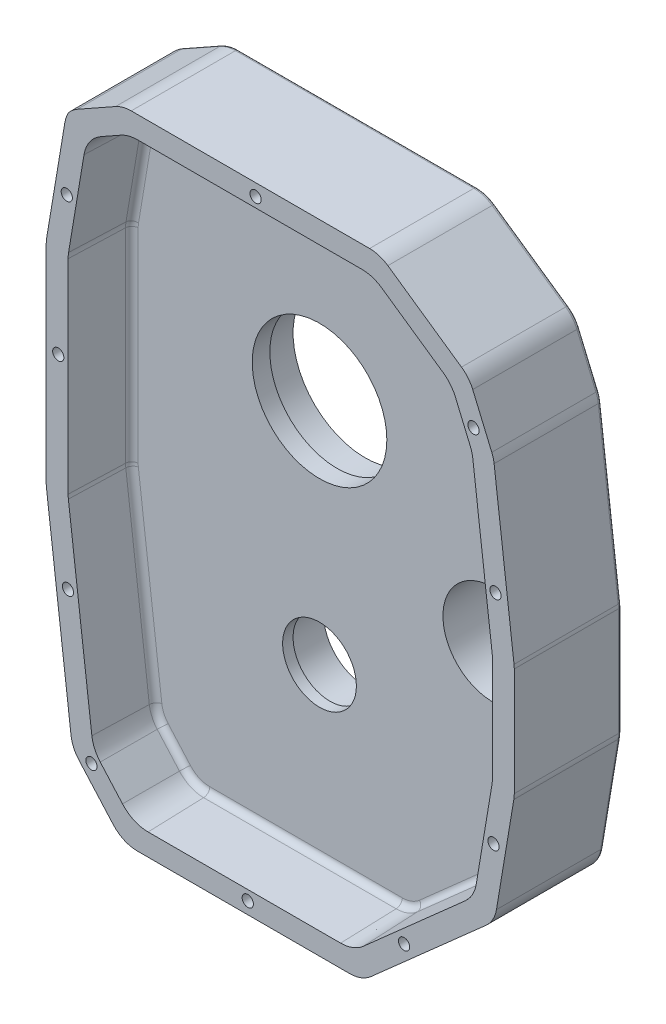
from build123d import *

# Parameters (mm, degrees)
ESTRUSIONE_ESTRUSIONE1_DEPTH   = 77
SCHIZZO2_R                     = 45.00000000000001
SCHIZZO2_R_2                   = 31.00000000000002
SCHIZZO2_R_3                   = 26.000000000000004
TAGLIO_ESTRUSIONE1_DEPTH       = 485.5269982106822
TAGLIO_ESTRUSIONE2_DEPTH       = 48.5
FORO_FILETTATO_M8_1_AT_2_COUNT = 2
FORO_FILETTATO_M8_1_AT_2_PITCH = 103.92304845413265
FORO_FILETTATO_M8_1_AT_3_COUNT = 2
FORO_FILETTATO_M8_1_AT_3_PITCH = 103.92304845413267
FORO_FILETTATO_M8_1_AT_4_COUNT = 2
FORO_FILETTATO_M8_1_AT_4_PITCH = 146.24517509154336
FORO_FILETTATO_M8_1_AT_5_COUNT = 2
FORO_FILETTATO_M8_1_AT_5_PITCH = 173.75803258941207
FORO_FILETTATO_M8_1_AT_6_COUNT = 2
FORO_FILETTATO_M8_1_AT_6_PITCH = 211.6200982542094
FORO_FILETTATO_M8_1_AT_7_COUNT = 2
FORO_FILETTATO_M8_1_AT_7_PITCH = 168.5
FORO_FILETTATO_M8_1_AT_8_COUNT = 2
FORO_FILETTATO_M8_1_AT_8_PITCH = 221.46613736641547
FORO_FILETTATO_M8_1_AT_9_COUNT = 2
FORO_FILETTATO_M8_1_AT_9_PITCH = 221.46613736641547
SCHIZZO10_R                    = 3.5000000000000075
SCHIZZO10_R_2                  = 3.500000000000021
SCHIZZO10_R_3                  = 3.500000000000001
SCHIZZO10_R_4                  = 3.500000000000007
SCHIZZO10_R_5                  = 3.4999999999999933
SCHIZZO10_R_6                  = 3.4999999999999996
TAGLIO_ESTRUSIONE3_DEPTH       = 485.5269982106822
TAGLIO_ESTRUSIONE4_START       = 77
TAGLIO_ESTRUSIONE4_DEPTH       = 87
RACCORDO1_R                    = 20
RACCORDO2_R                    = 2
ESTRUSIONE_ESTRUSIONE3_START   = -11
SCHIZZO12_R                    = 44.99999999999998
SCHIZZO12_R_2                  = 41.99999999999998
ESTRUSIONE_ESTRUSIONE3_DEPTH   = 11
ESTRUSIONE_ESTRUSIONE4_START   = -6.5
SCHIZZO13_R                    = 26.000000000000004
SCHIZZO13_R_2                  = 22.999999999999986
ESTRUSIONE_ESTRUSIONE4_DEPTH   = 6.5
RACCORDO4_R                    = 20
SFORMO1_ANGLE                  = 2.0000000000000044
RACCORDO5_R                    = 4


with BuildPart() as part:
    # Schizzo1 → Estrusione-Estrusione1 (new body)
    with BuildSketch(Plane.XY):
        Polygon((59.97203866307139, -9.548657155468725), (184.10741549748292, -9.548657155468723), (266.9069284985725, 63.82426858351747), (279.1826753889554, 137.3777870418758), (279.1826753889554, 207.62899219262553), (266.2641129808191, 313.83800459040253), (251.0013978020814, 349.7306588644845), (195.19631847388604, 388.4513428445313), (34.97510700608368, 388.45134284453127), (2.5691605785714486, 370.25525465443536), (-0.4487972003918185, 365.90570924477845), (-12.817324611044688, 291.79627074577445), (-12.817324611044684, 270.1406472453184), (-12.817324611044674, 159.54273071121807), (-8.096788353345598, 120.73318843565089), (-1.2777496964637207, 64.67096275072858), (3.418345684776214, 26.06235934659699), (34.97510700608368, -9.548657155468725), align=None)
    estrusione_estrusione1 = extrude(amount=ESTRUSIONE_ESTRUSIONE1_DEPTH)

    # Schizzo2 → Taglio-Estrusione1 (cut, through all)
    with BuildSketch(Plane.XY.offset(77)):
        with Locations((119.18267538895532, 251.95134284453124)):
            Circle(SCHIZZO2_R)
        with Locations((227.1857552774219, 174.34614028319743)):
            Circle(SCHIZZO2_R_2)
        with Locations((119.18267538895533, 109.45134284453127)):
            Circle(SCHIZZO2_R_3)
    taglio_estrusione1 = extrude(amount=-TAGLIO_ESTRUSIONE1_DEPTH, mode=Mode.SUBTRACT)

    # Schizzo4 → Taglio-Estrusione2 (cut)
    with BuildSketch(Plane(origin=(0, 0, 0), x_dir=(-1, 0, 0), z_dir=(0, 0, -1))):
        Polygon((-190.50206074448187, 373.4513428445313), (-238.89227938799723, 339.8755037564531), (-251.63003788980453, 309.9206787611581), (-264.1826753889553, 206.72009113753535), (-264.1826753889553, 138.62090581781547), (-252.98547965028263, 71.52982363759074), (-178.41756547195982, 5.451342844531276), (-41.72490216868169, 5.451342844531273), (-17.744303444365826, 32.512849195134365), (-2.1826753889553263, 160.4516317663086), (-2.1826753889553108, 290.55315196983486), (-13.652120373026488, 359.27549048627293), (-38.898311053509296, 373.45134284453127), align=None)
    taglio_estrusione2 = extrude(amount=-TAGLIO_ESTRUSIONE2_DEPTH, mode=Mode.SUBTRACT)

    # Schizzo9 → Foro filettato M8-1 (revolve, cut)
    with BuildSketch(Plane(origin=(119.18267538895532, 311.95134284453127, 77), x_dir=(0, -1, 0), z_dir=(1, 0, 0))):
        Polygon((0, 0), (-6.13e-15, 25.042926104693706), (3.3999999999999946, 23), (3.3999999999999972, 0.625000000000004), (4.025, 0), align=None)
    foro_filettato_m8_1 = revolve(axis=Axis((119.18267538895532, 311.95134284453127, 83.35), (0, 0, -1)), mode=Mode.SUBTRACT)

    # Foro filettato M8-1 at 2: Foro filettato M8-1 ×2
    with Locations(*[Vector(-0.5000000000000003, -0.8660254037844385, 0) * (i * FORO_FILETTATO_M8_1_AT_2_PITCH) for i in range(1, FORO_FILETTATO_M8_1_AT_2_COUNT)]):
        add(foro_filettato_m8_1, mode=Mode.SUBTRACT)

    # Foro filettato M8-1 at 3: Foro filettato M8-1 ×2
    with Locations(*[Vector(0.4999999999999996, -0.8660254037844389, 0) * (i * FORO_FILETTATO_M8_1_AT_3_PITCH) for i in range(1, FORO_FILETTATO_M8_1_AT_3_COUNT)]):
        add(foro_filettato_m8_1, mode=Mode.SUBTRACT)

    # Foro filettato M8-1 at 4: Foro filettato M8-1 ×2
    with Locations(*[Vector(0.7385069614834211, -0.6742458511852519, 0) * (i * FORO_FILETTATO_M8_1_AT_4_PITCH) for i in range(1, FORO_FILETTATO_M8_1_AT_4_COUNT)]):
        add(foro_filettato_m8_1, mode=Mode.SUBTRACT)

    # Foro filettato M8-1 at 5: Foro filettato M8-1 ×2
    with Locations(*[Vector(0.42719227442148505, -0.9041608046551226, 0) * (i * FORO_FILETTATO_M8_1_AT_5_PITCH) for i in range(1, FORO_FILETTATO_M8_1_AT_5_COUNT)]):
        add(foro_filettato_m8_1, mode=Mode.SUBTRACT)

    # Foro filettato M8-1 at 6: Foro filettato M8-1 ×2
    with Locations(*[Vector(0.6699650543860357, -0.7423926359424078, 0) * (i * FORO_FILETTATO_M8_1_AT_6_PITCH) for i in range(1, FORO_FILETTATO_M8_1_AT_6_COUNT)]):
        add(foro_filettato_m8_1, mode=Mode.SUBTRACT)

    # Foro filettato M8-1 at 7: Foro filettato M8-1 ×2
    with Locations(*[(0, -i * FORO_FILETTATO_M8_1_AT_7_PITCH, 0) for i in range(1, FORO_FILETTATO_M8_1_AT_7_COUNT)]):
        add(foro_filettato_m8_1, mode=Mode.SUBTRACT)

    # Foro filettato M8-1 at 8: Foro filettato M8-1 ×2
    with Locations(*[Vector(-0.13295424789910176, -0.9911221761042299, 0) * (i * FORO_FILETTATO_M8_1_AT_8_PITCH) for i in range(1, FORO_FILETTATO_M8_1_AT_8_COUNT)]):
        add(foro_filettato_m8_1, mode=Mode.SUBTRACT)

    # Foro filettato M8-1 at 9: Foro filettato M8-1 ×2
    with Locations(*[Vector(0.13295424789910176, -0.9911221761042299, 0) * (i * FORO_FILETTATO_M8_1_AT_9_PITCH) for i in range(1, FORO_FILETTATO_M8_1_AT_9_COUNT)]):
        add(foro_filettato_m8_1, mode=Mode.SUBTRACT)

    # Schizzo10 → Taglio-Estrusione3 (cut, through all)
    with BuildSketch(Plane(origin=(0, 0, 0), x_dir=(-1, 0, 0), z_dir=(0, 0, -1))):
        with Locations((-117.80707355078968, 380.95134284453127)):
            Circle(SCHIZZO10_R)
        with Locations((-253.77198100419457, 324.04938305286004)):
            Circle(SCHIZZO10_R_2)
        with Locations((5.317324611044673, 234.1316845005394)):
            Circle(SCHIZZO10_R_3)
        with Locations((-266.25474899561414, 105.47643049419624)):
            Circle(SCHIZZO10_R_2)
        with Locations((-0.7392385346214547, 110.2035919907182)):
            Circle(SCHIZZO10_R_3)
        with Locations((-112.91910280426978, -2.0486571554687236)):
            Circle(SCHIZZO10_R_4)
        with Locations((0.0028470657826218, 323.0178672743057)):
            Circle(SCHIZZO10_R_3)
        with Locations((-267.4811778656179, 241.7168450923049)):
            Circle(SCHIZZO10_R_2)
        with Locations((-210.41910280426978, 23.451342844531275)):
            Circle(SCHIZZO10_R_5)
        with Locations((-15.41910280426978, 23.451342844531275)):
            Circle(SCHIZZO10_R_6)
    taglio_estrusione3 = extrude(amount=-TAGLIO_ESTRUSIONE3_DEPTH, mode=Mode.SUBTRACT)

    # Specchia1: Estrusione-Estrusione1, Taglio-Estrusione1, Taglio-Estrusione2, Foro filettato M8-1, Taglio-Estrusione3 across Front Plane
    add(estrusione_estrusione1.mirror(Plane.XY))
    add(taglio_estrusione1.mirror(Plane.XY), mode=Mode.SUBTRACT)
    add(taglio_estrusione2.mirror(Plane.XY), mode=Mode.SUBTRACT)
    add(foro_filettato_m8_1.mirror(Plane.XY), mode=Mode.SUBTRACT)
    add(taglio_estrusione3.mirror(Plane.XY), mode=Mode.SUBTRACT)

    # Specchia1 copy 1 sketch → Specchia1 copy 1 (revolve, cut)
    with BuildSketch(Plane(origin=(67.22115116188895, 221.95134284453127, -77), x_dir=(0, -1, 0), z_dir=(1, 0, 0))):
        Polygon((0, 0), (-6.13e-15, -25.042926104693706), (3.3999999999999946, -23), (3.3999999999999972, -0.625000000000004), (4.025, 0), align=None)
    revolve(axis=Axis((67.22115116188895, 221.95134284453127, -83.35), (0, 0, -1)), mode=Mode.SUBTRACT)

    # Specchia1 copy 2 sketch → Specchia1 copy 2 (revolve, cut)
    with BuildSketch(Plane(origin=(171.1441996160216, 221.9513428445312, -77), x_dir=(0, -1, 0), z_dir=(1, 0, 0))):
        Polygon((0, 0), (-6.13e-15, -25.042926104693706), (3.3999999999999946, -23), (3.3999999999999972, -0.625000000000004), (4.025, 0), align=None)
    revolve(axis=Axis((171.1441996160216, 221.9513428445312, -83.35), (0, 0, -1)), mode=Mode.SUBTRACT)

    # Specchia1 copy 3 sketch → Specchia1 copy 3 (revolve, cut)
    with BuildSketch(Plane(origin=(227.1857552774219, 213.34614028319743, -77), x_dir=(0, -1, 0), z_dir=(1, 0, 0))):
        Polygon((0, 0), (-6.13e-15, -25.042926104693706), (3.3999999999999946, -23), (3.3999999999999972, -0.625000000000004), (4.025, 0), align=None)
    revolve(axis=Axis((227.1857552774219, 213.34614028319743, -83.35), (0, 0, -1)), mode=Mode.SUBTRACT)

    # Specchia1 copy 4 sketch → Specchia1 copy 4 (revolve, cut)
    with BuildSketch(Plane(origin=(193.41076452982878, 154.84614028319743, -77), x_dir=(0, -1, 0), z_dir=(1, 0, 0))):
        Polygon((0, 0), (-6.13e-15, -25.042926104693706), (3.3999999999999946, -23), (3.3999999999999972, -0.625000000000004), (4.025, 0), align=None)
    revolve(axis=Axis((193.41076452982878, 154.84614028319743, -83.35), (0, 0, -1)), mode=Mode.SUBTRACT)

    # Specchia1 copy 5 sketch → Specchia1 copy 5 (revolve, cut)
    with BuildSketch(Plane(origin=(260.96074602501494, 154.84614028319743, -77), x_dir=(0, -1, 0), z_dir=(1, 0, 0))):
        Polygon((0, 0), (-6.13e-15, -25.042926104693706), (3.3999999999999946, -23), (3.3999999999999972, -0.625000000000004), (4.025, 0), align=None)
    revolve(axis=Axis((260.96074602501494, 154.84614028319743, -83.35), (0, 0, -1)), mode=Mode.SUBTRACT)

    # Specchia1 copy 6 sketch → Specchia1 copy 6 (revolve, cut)
    with BuildSketch(Plane(origin=(119.18267538895533, 143.45134284453127, -77), x_dir=(0, -1, 0), z_dir=(1, 0, 0))):
        Polygon((0, 0), (-6.13e-15, -25.042926104693706), (3.3999999999999946, -23), (3.3999999999999972, -0.625000000000004), (4.025, 0), align=None)
    revolve(axis=Axis((119.18267538895533, 143.45134284453127, -83.35), (0, 0, -1)), mode=Mode.SUBTRACT)

    # Specchia1 copy 7 sketch → Specchia1 copy 7 (revolve, cut)
    with BuildSketch(Plane(origin=(89.7378116602844, 92.45134284453127, -77), x_dir=(0, -1, 0), z_dir=(1, 0, 0))):
        Polygon((0, 0), (-6.13e-15, -25.042926104693706), (3.3999999999999946, -23), (3.3999999999999972, -0.625000000000004), (4.025, 0), align=None)
    revolve(axis=Axis((89.7378116602844, 92.45134284453127, -83.35), (0, 0, -1)), mode=Mode.SUBTRACT)

    # Specchia1 copy 8 sketch → Specchia1 copy 8 (revolve, cut)
    with BuildSketch(Plane(origin=(148.62753911762624, 92.45134284453127, -77), x_dir=(0, -1, 0), z_dir=(1, 0, 0))):
        Polygon((0, 0), (-6.13e-15, -25.042926104693706), (3.3999999999999946, -23), (3.3999999999999972, -0.625000000000004), (4.025, 0), align=None)
    revolve(axis=Axis((148.62753911762624, 92.45134284453127, -83.35), (0, 0, -1)), mode=Mode.SUBTRACT)

    # Schizzo1<2> → Taglio-Estrusione4 (cut)
    with BuildSketch(Plane.XY.offset(TAGLIO_ESTRUSIONE4_START)):
        Polygon((59.97203866307139, -9.548657155468725), (184.10741549748292, -9.548657155468723), (266.9069284985725, 63.82426858351747), (279.1826753889554, 137.3777870418758), (279.1826753889554, 207.62899219262553), (266.2641129808191, 313.83800459040253), (251.0013978020814, 349.7306588644845), (195.19631847388604, 388.4513428445313), (34.97510700608368, 388.45134284453127), (2.5691605785714486, 370.25525465443536), (-0.4487972003918185, 365.90570924477845), (-12.817324611044688, 291.79627074577445), (-12.817324611044684, 270.1406472453184), (-12.817324611044674, 159.54273071121807), (-8.096788353345598, 120.73318843565089), (-1.2777496964637207, 64.67096275072858), (3.418345684776214, 26.06235934659699), (34.97510700608368, -9.548657155468725), align=None)
    extrude(amount=-TAGLIO_ESTRUSIONE4_DEPTH, mode=Mode.SUBTRACT)

    # Raccordo1
    # the kernel refuses this fillet: 20 mm, written as the material it takes off along each edge
    with BuildSketch(Plane(origin=(195.19631847388604, 388.4513428445313, -92.64752576468064), x_dir=(0.8215964420750854, -0.570069545204408, 0), z_dir=(0, 0, 1))) as raccordo1_piece_1:
        with BuildLine():
            CenterArc((RACCORDO1_R * 0.312950515294, -RACCORDO1_R), RACCORDO1_R, 90.00000000000003, 34.75507549437218)
            Line((-RACCORDO1_R * 0.257119029911, -RACCORDO1_R * 0.178403557925), (0, 0))
            Line((0, 0), (RACCORDO1_R * 0.312950515294, 1e-16))
        make_face()
    extrude(amount=98.29505152936127, mode=Mode.SUBTRACT)
    with BuildSketch(Plane(origin=(34.975107006083675, 388.45134284453127, 3.0773468247521976), x_dir=(1, 0, 0), z_dir=(0, 0, -1))) as raccordo1_piece_2:
        with BuildLine():
            CenterArc((RACCORDO1_R * 0.261546936495, RACCORDO1_R), RACCORDO1_R, 240.68558878839565, 29.314411211604295)
            Line((-RACCORDO1_R * 0.228054845331, RACCORDO1_R * 0.128053846139), (0, 0))
            Line((0, 0), (RACCORDO1_R * 0.261546936495, 0))
        make_face()
    extrude(amount=93.15469364950437, mode=Mode.SUBTRACT)
    with BuildSketch(Plane(origin=(-0.44879720039181487, 365.90570924477845, 1.2129806364600881), x_dir=(-0.16461853760397155, -0.9863573070024523, 0), z_dir=(0, 0, -1))) as raccordo1_piece_3:
        with BuildLine():
            CenterArc((RACCORDO1_R * 0.224259612729, -RACCORDO1_R), RACCORDO1_R, 90.00000000000014, 25.280000228329982)
            Line((-RACCORDO1_R * 0.202782643888, -RACCORDO1_R * 0.0957683310879), (0, 0))
            Line((0, 0), (RACCORDO1_R * 0.224259612729, -9e-17))
        make_face()
    extrude(amount=89.42596127292018, mode=Mode.SUBTRACT)
    with BuildSketch(Plane(origin=(2.5691605785714513, 370.25525465443536, 1.511478705269397), x_dir=(-0.5700695452044089, -0.821596442075085, 0), z_dir=(0, 0, -1))) as raccordo1_piece_4:
        with BuildLine():
            CenterArc((RACCORDO1_R * 0.230229574105, -RACCORDO1_R), RACCORDO1_R, 90.00000000000009, 25.9305132940234)
            Line((-RACCORDO1_R * 0.207051218491, -RACCORDO1_R * 0.100674970644), (0, 0))
            Line((0, 0), (RACCORDO1_R * 0.230229574105, -2e-17))
        make_face()
    extrude(amount=90.02295741053878, mode=Mode.SUBTRACT)
    with BuildSketch(Plane(origin=(-12.817324611044688, 291.79627074577445, -5.8562707468679776), x_dir=(0, -1, 0), z_dir=(0, 0, -1))) as raccordo1_piece_5:
        with BuildLine():
            CenterArc((RACCORDO1_R * 0.0828745850626, -RACCORDO1_R), RACCORDO1_R, 90, 9.475075266042111)
            Line((-RACCORDO1_R * 0.0817439525413, -RACCORDO1_R * 0.0136426929975), (0, 0))
            Line((0, 0), (RACCORDO1_R * 0.0828745850626, 0))
        make_face()
    extrude(amount=75.28745850626404, mode=Mode.SUBTRACT)
    with BuildSketch(Plane(origin=(-12.817324611044667, 159.542730711218, -6.970329816364881), x_dir=(0.12074349030746913, -0.9926837409509486, 0), z_dir=(0, 0, -1))) as raccordo1_piece_6:
        with BuildLine():
            CenterArc((RACCORDO1_R * 0.0605934036727, -RACCORDO1_R), RACCORDO1_R, 89.99999999999996, 6.935013446882152)
            Line((-RACCORDO1_R * 0.0601500866348, -RACCORDO1_R * 0.00731625904905), (0, 0))
            Line((0, 0), (RACCORDO1_R * 0.0605934036727, 0))
        make_face()
    extrude(amount=73.05934036727024, mode=Mode.SUBTRACT)
    with BuildSketch(Plane(origin=(3.4183456847762157, 26.06235934659699, 5.578434173073163), x_dir=(0.6632186619985212, -0.7484256852733552, 0), z_dir=(0, 0, -1))) as raccordo1_piece_7:
        with BuildLine():
            CenterArc((RACCORDO1_R * 0.311568683461, -RACCORDO1_R), RACCORDO1_R, 90.00000000000004, 34.61079724816966)
            Line((-RACCORDO1_R * 0.256430169524, -RACCORDO1_R * 0.176970654832), (0, 0))
            Line((0, 0), (RACCORDO1_R * 0.311568683461, 3.3e-16))
        make_face()
    extrude(amount=98.15686834614633, mode=Mode.SUBTRACT)
    with BuildSketch(Plane(origin=(34.97510700608369, -9.548657155468725, 12.499317208660003), x_dir=(1, 0, 0), z_dir=(0, 0, -1))) as raccordo1_piece_8:
        with BuildLine():
            CenterArc((RACCORDO1_R * 0.449986344173, -RACCORDO1_R), RACCORDO1_R, 90, 48.45418930494819)
            Line((-RACCORDO1_R * 0.2984393411, -RACCORDO1_R * 0.336781338001), (0, 0))
            Line((0, 0), (RACCORDO1_R * 0.449986344173, 0))
        make_face()
    extrude(amount=111.99863441731999, mode=Mode.SUBTRACT)
    with BuildSketch(Plane(origin=(184.10741549748292, -9.548657155468723, -95.96616675174361), x_dir=(-1, 0, 0), z_dir=(0, 0, 1))) as raccordo1_piece_9:
        with BuildLine():
            CenterArc((RACCORDO1_R * 0.379323335035, -RACCORDO1_R), RACCORDO1_R, 90, 41.54581069505181)
            Line((-RACCORDO1_R * 0.283895326964, -RACCORDO1_R * 0.251574314727), (0, 0))
            Line((0, 0), (RACCORDO1_R * 0.379323335035, 0))
        make_face()
    extrude(amount=104.93233350348723, mode=Mode.SUBTRACT)
    with BuildSketch(Plane(origin=(266.9069284985725, 63.82426858351747, -94.69567327120288), x_dir=(-0.7484256852733557, -0.6632186619985205, 0), z_dir=(0, 0, 1))) as raccordo1_piece_10:
        with BuildLine():
            CenterArc((RACCORDO1_R * 0.353913465424, -RACCORDO1_R), RACCORDO1_R, 90.00000000000001, 38.979114038905934)
            Line((-RACCORDO1_R * 0.275123591744, -RACCORDO1_R * 0.222624684782), (0, 0))
            Line((0, 0), (RACCORDO1_R * 0.353913465424, 1.2e-16))
        make_face()
    extrude(amount=102.39134654240577, mode=Mode.SUBTRACT)
    with BuildSketch(Plane(origin=(279.1826753889554, 137.3777870418758, -81.14372925313204), x_dir=(-0.1646185376039625, -0.9863573070024537, 0), z_dir=(0, 0, 1))) as raccordo1_piece_11:
        with BuildLine():
            CenterArc((RACCORDO1_R * 0.0828745850626, -RACCORDO1_R), RACCORDO1_R, 89.99999999999943, 9.475075266042182)
            Line((-RACCORDO1_R * 0.0817439525413, -RACCORDO1_R * 0.0136426929975), (0, 0))
            Line((0, 0), (RACCORDO1_R * 0.0828745850626, -3e-17))
        make_face()
    extrude(amount=75.28745850626406, mode=Mode.SUBTRACT)
    with BuildSketch(Plane(origin=(279.1826753889554, 207.62899219262553, -80.02967018363512), x_dir=(0, -1, 0), z_dir=(0, 0, 1))) as raccordo1_piece_12:
        with BuildLine():
            CenterArc((RACCORDO1_R * 0.0605934036727, -RACCORDO1_R), RACCORDO1_R, 90, 6.935013446882138)
            Line((-RACCORDO1_R * 0.0601500866348, -RACCORDO1_R * 0.00731625904905), (0, 0))
            Line((0, 0), (RACCORDO1_R * 0.0605934036727, 0))
        make_face()
    extrude(amount=73.05934036727024, mode=Mode.SUBTRACT)
    with BuildSketch(Plane(origin=(266.2641129808191, 313.83800459040253, -84.07232118262445), x_dir=(0.12074349030746688, -0.9926837409509489, 0), z_dir=(0, 0, 1))) as raccordo1_piece_13:
        with BuildLine():
            CenterArc((RACCORDO1_R * 0.141446423652, -RACCORDO1_R), RACCORDO1_R, 90.00000000000018, 16.101750131646995)
            Line((-RACCORDO1_R * 0.135897577057, -RACCORDO1_R * 0.0392293170219), (0, 0))
            Line((0, 0), (RACCORDO1_R * 0.141446423652, 0))
        make_face()
    extrude(amount=81.14464236524891, mode=Mode.SUBTRACT)
    with BuildSketch(Plane(origin=(251.0013978020814, 349.73065886448455, -91.43561605107718), x_dir=(0.39132168580287185, -0.9202539531131602, 0), z_dir=(0, 0, 1))) as raccordo1_piece_14:
        with BuildLine():
            CenterArc((RACCORDO1_R * 0.288712321022, -RACCORDO1_R), RACCORDO1_R, 90.00000000000028, 32.20816092709879)
            Line((-RACCORDO1_R * 0.244284477207, -RACCORDO1_R * 0.153882742714), (0, 0))
            Line((0, 0), (RACCORDO1_R * 0.288712321022, 1.6e-16))
        make_face()
    extrude(amount=95.87123210215435, mode=Mode.SUBTRACT)

    # Raccordo2
    # the kernel refuses this fillet: 2 mm, written as the material it takes off along each edge
    with BuildSketch(Plane(origin=(188.93730816801482, 388.4513428445313, -77), x_dir=(3.5e-16, -1, 0), z_dir=(-1, -3.5e-16, 0))) as raccordo2_piece_1:
        with BuildLine():
            CenterArc((RACCORDO2_R, RACCORDO2_R), RACCORDO2_R, 180, 90)
            Line((0, RACCORDO2_R), (0, 0))
            Line((0, 0), (RACCORDO2_R, 0))
        make_face()
    extrude(amount=148.73126243203083, mode=Mode.SUBTRACT)
    with BuildSketch(Plane(origin=(176.520948796783, -9.548657155468723, -77), x_dir=(0, 0, 1), z_dir=(-1, -1e-17, 0))) as raccordo2_piece_2:
        with BuildLine():
            CenterArc((RACCORDO2_R, RACCORDO2_R), RACCORDO2_R, 180.00000000000026, 89.99999999999977)
            Line((0, RACCORDO2_R), (0, 0))
            Line((0, 0), (RACCORDO2_R, 0))
        make_face()
    extrude(amount=132.54611490723897, mode=Mode.SUBTRACT)
    with BuildSketch(Plane(origin=(7.551108992089016, 21.398639238016777, -77), x_dir=(0.7484256852733556, 0.6632186619985209, 0), z_dir=(0.6632186619985209, -0.7484256852733556, 0))) as raccordo2_piece_3:
        with BuildLine():
            CenterArc((RACCORDO2_R, RACCORDO2_R), RACCORDO2_R, 180, 90)
            Line((0, RACCORDO2_R), (0, 0))
            Line((0, 0), (RACCORDO2_R, 0))
        make_face()
    extrude(amount=32.35013189668343, mode=Mode.SUBTRACT)
    with BuildSketch(Plane(origin=(2.665947878543195, 32.248142671832454, -77), x_dir=(0.9926837409509485, 0.12074349030747038, 0), z_dir=(-0.12074349030747038, 0.9926837409509485, 0))) as raccordo2_piece_4:
        with BuildLine():
            CenterArc((RACCORDO2_R, -RACCORDO2_R), RACCORDO2_R, 90, 90)
            Line((5.43e-15, -RACCORDO2_R), (0, 0))
            Line((0, 0), (RACCORDO2_R, 0))
        make_face()
    extrude(amount=127.02090414606764, mode=Mode.SUBTRACT)
    with BuildSketch(Plane(origin=(-12.817324611044674, 160.75459878467237, -77), x_dir=(1, 1.1e-16, 0), z_dir=(-1.1e-16, 1, 0))) as raccordo2_piece_5:
        with BuildLine():
            CenterArc((RACCORDO2_R, -RACCORDO2_R), RACCORDO2_R, 90, 90)
            Line((-8.88e-15, -RACCORDO2_R), (0, 0))
            Line((0, 0), (RACCORDO2_R, 0))
        make_face()
    extrude(amount=129.38418025984961, mode=Mode.SUBTRACT)
    with BuildSketch(Plane(origin=(-1.1871429902135266, 361.48170709116215, -77), x_dir=(0.986357307002452, -0.1646185376039725, 0), z_dir=(-0.16461853760397252, -0.9863573070024522, 0))) as raccordo2_piece_6:
        with BuildLine():
            CenterArc((RACCORDO2_R, RACCORDO2_R), RACCORDO2_R, 180, 90)
            Line((1.001e-14, RACCORDO2_R), (0, 0))
            Line((0, 0), (RACCORDO2_R, 0))
        make_face()
    extrude(amount=68.99179112016498, mode=Mode.SUBTRACT)
    with BuildSketch(Plane(origin=(30.414010099464555, 385.8902659217491, -77), x_dir=(0.48960178182599706, -0.8719461538608957, 0), z_dir=(-0.8719461538608957, -0.48960178182599706, 0))) as raccordo2_piece_7:
        with BuildLine():
            CenterArc((RACCORDO2_R, RACCORDO2_R), RACCORDO2_R, 180, 90)
            Line((1.565e-14, RACCORDO2_R), (0, 0))
            Line((0, 0), (RACCORDO2_R, 0))
        make_face()
    extrude(amount=27.329547337813274, mode=Mode.SUBTRACT)
    with BuildSketch(Plane(origin=(246.2572974873956, 353.02238089527424, -77), x_dir=(-0.5700695452044079, -0.8215964420750858, 0), z_dir=(-0.8215964420750858, 0.5700695452044079, 0))) as raccordo2_piece_8:
        with BuildLine():
            CenterArc((RACCORDO2_R, RACCORDO2_R), RACCORDO2_R, 180, 90)
            Line((-1.62e-14, RACCORDO2_R), (0, 0))
            Line((0, 0), (RACCORDO2_R, 0))
        make_face()
    extrude(amount=55.889480605967194, mode=Mode.SUBTRACT)
    with BuildSketch(Plane(origin=(265.15709192172903, 316.44133720080214, -77), x_dir=(-0.9202539531131583, -0.3913216858028763, 0), z_dir=(-0.3913216858028763, 0.9202539531131584, 0))) as raccordo2_piece_9:
        with BuildLine():
            CenterArc((RACCORDO2_R, RACCORDO2_R), RACCORDO2_R, 180, 90)
            Line((2.224e-14, RACCORDO2_R), (0, 0))
            Line((0, 0), (RACCORDO2_R, 0))
        make_face()
    extrude(amount=30.39981352363022, mode=Mode.SUBTRACT)
    with BuildSketch(Plane(origin=(279.03635020797424, 208.8319939253217, -77), x_dir=(-0.9926837409509485, -0.12074349030747052, 0), z_dir=(-0.12074349030747053, 0.9926837409509486, 0))) as raccordo2_piece_10:
        with BuildLine():
            CenterArc((RACCORDO2_R, RACCORDO2_R), RACCORDO2_R, 180, 90)
            Line((0, RACCORDO2_R), (0, 0))
            Line((0, 0), (RACCORDO2_R, 0))
        make_face()
    extrude(amount=102.95099551814982, mode=Mode.SUBTRACT)
    with BuildSketch(Plane(origin=(279.1826753889554, 139.03527874312877, -77), x_dir=(-1, 0, 0), z_dir=(0, 1, 0))) as raccordo2_piece_11:
        with BuildLine():
            CenterArc((RACCORDO2_R, RACCORDO2_R), RACCORDO2_R, 180, 90)
            Line((0, RACCORDO2_R), (0, 0))
            Line((0, 0), (RACCORDO2_R, 0))
        make_face()
    extrude(amount=67.3818453760432, mode=Mode.SUBTRACT)
    with BuildSketch(Plane(origin=(268.07214284090156, 70.80597123686809, -77), x_dir=(-0.9863573070024519, 0.16461853760397313, 0), z_dir=(0.16461853760397316, 0.986357307002452, 0))) as raccordo2_piece_12:
        with BuildLine():
            CenterArc((RACCORDO2_R, RACCORDO2_R), RACCORDO2_R, 180, 90)
            Line((-2.34e-15, RACCORDO2_R), (0, 0))
            Line((0, 0), (RACCORDO2_R, 0))
        make_face()
    extrude(amount=65.83510487850077, mode=Mode.SUBTRACT)
    with BuildSketch(Plane(origin=(189.78532203675886, -4.5171708609332155, -77), x_dir=(-0.663218661998521, 0.7484256852733554, 0), z_dir=(0.7484256852733554, 0.663218661998521, 0))) as raccordo2_piece_13:
        with BuildLine():
            CenterArc((RACCORDO2_R, RACCORDO2_R), RACCORDO2_R, 180, 90)
            Line((1.263e-14, RACCORDO2_R), (0, 0))
            Line((0, 0), (RACCORDO2_R, 0))
        make_face()
    extrude(amount=95.96683988448574, mode=Mode.SUBTRACT)
    with BuildSketch(Plane(origin=(234.85590658330793, 336.5904520537652, -77), x_dir=(0.570069545204261, 0.8215964420751876, 0), z_dir=(-0.8215964420751876, 0.570069545204261, 0))) as raccordo2_piece_14:
        with BuildLine():
            CenterArc((19.999999999999996 - RACCORDO2_R, -RACCORDO2_R), RACCORDO2_R, 0, 90)
            Line((20.000000000000014, -RACCORDO2_R), (19.999999999999996, 0))
            Line((19.999999999999996, 0), (19.999999999999996 - RACCORDO2_R, 0))
        make_face()
    revolve(axis=Axis((234.85590658330793, 336.5904520537652, -77), (0, 0, -1)), revolution_arc=32.20816092709905, mode=Mode.SUBTRACT)
    with BuildSketch(Plane(origin=(246.75201285946258, 308.6149034847628, -77), x_dir=(0.9202539531133431, 0.39132168580244153, 0), z_dir=(-0.39132168580244153, 0.9202539531133431, 0))) as raccordo2_piece_15:
        with BuildLine():
            CenterArc((19.999999999999986 - RACCORDO2_R, -RACCORDO2_R), RACCORDO2_R, 0, 90)
            Line((20.00000000000004, -RACCORDO2_R), (19.999999999999986, 0))
            Line((19.999999999999986, 0), (19.999999999999986 - RACCORDO2_R, 0))
        make_face()
    revolve(axis=Axis((246.75201285946258, 308.6149034847628, -77), (0, 0, -1)), revolution_arc=16.10175013164704, mode=Mode.SUBTRACT)
    with BuildSketch(Plane(origin=(259.182675388955, 206.41712411917197, -77), x_dir=(0.9926837409509487, 0.12074349030746842, 0), z_dir=(-0.12074349030746842, 0.9926837409509487, 0))) as raccordo2_piece_16:
        with BuildLine():
            CenterArc((20 - RACCORDO2_R, -RACCORDO2_R), RACCORDO2_R, 0, 90)
            Line((20, -RACCORDO2_R), (20, 0))
            Line((20, 0), (20 - RACCORDO2_R, 0))
        make_face()
    revolve(axis=Axis((259.182675388955, 206.41712411917197, -77), (0, 0, -1)), revolution_arc=6.935013446881954, mode=Mode.SUBTRACT)
    with BuildSketch(Plane(origin=(259.18267538895526, 139.03527874313164, -77), x_dir=(1, -1.0516e-13, 0), z_dir=(1.0516e-13, 1, 0))) as raccordo2_piece_17:
        with BuildLine():
            CenterArc((20 - RACCORDO2_R, -RACCORDO2_R), RACCORDO2_R, 0, 90)
            Line((20, -RACCORDO2_R), (20, 0))
            Line((20, 0), (20 - RACCORDO2_R, 0))
        make_face()
    revolve(axis=Axis((259.18267538895526, 139.03527874313164, -77), (0, 0, -1)), revolution_arc=9.475075266041962, mode=Mode.SUBTRACT)
    with BuildSketch(Plane(origin=(248.34499670084693, 74.09834198893778, -77), x_dir=(0.9863573070025499, -0.16461853760338632, 0), z_dir=(0.16461853760338632, 0.9863573070025499, 0))) as raccordo2_piece_18:
        with BuildLine():
            CenterArc((19.999999999999993 - RACCORDO2_R, -RACCORDO2_R), RACCORDO2_R, 0, 90)
            Line((19.999999999999993, -RACCORDO2_R), (19.999999999999993, 0))
            Line((19.999999999999993, 0), (19.999999999999993 - RACCORDO2_R, 0))
        make_face()
    revolve(axis=Axis((248.34499670084693, 74.09834198893778, -77), (0, 0, -1)), revolution_arc=38.979114038906, mode=Mode.SUBTRACT)
    with BuildSketch(Plane(origin=(176.52094879678302, 10.451342844531, -77), x_dir=(0.6632186619985235, -0.7484256852733531, 0), z_dir=(0.7484256852733531, 0.6632186619985235, 0))) as raccordo2_piece_19:
        with BuildLine():
            CenterArc((19.999999999999996 - RACCORDO2_R, -RACCORDO2_R), RACCORDO2_R, 0, 90.00000000000041)
            Line((19.999999999999996 - RACCORDO2_R, 0), (19.999999999999996, 0))
            Line((19.999999999999996, 0), (19.999999999999996, -RACCORDO2_R))
        make_face()
    revolve(axis=Axis((176.52094879678302, 10.451342844531, -77), (0, 0, -1)), revolution_arc=41.54581069505202, mode=Mode.SUBTRACT)
    with BuildSketch(Plane(origin=(43.974833889544, 10.451342844531, -77), x_dir=(-0.7484256852733531, -0.6632186619985238, 0), z_dir=(-0.6632186619985238, 0.7484256852733531, 0))) as raccordo2_piece_20:
        with BuildLine():
            CenterArc((20.000000000000004 - RACCORDO2_R, RACCORDO2_R), RACCORDO2_R, 270.0000000000001, 89.99999999999989)
            Line((20.000000000000004 - RACCORDO2_R, 0), (20.000000000000004, 0))
            Line((20.000000000000004, 0), (20, RACCORDO2_R))
        make_face()
    revolve(axis=Axis((43.974833889544, 10.451342844531, -77), (0, 0, 1)), revolution_arc=48.45418930494796, mode=Mode.SUBTRACT)
    with BuildSketch(Plane(origin=(22.5196226975509, 34.66301247799845, -77), x_dir=(-0.9926837409508774, -0.12074349030805501, 0), z_dir=(-0.12074349030805501, 0.9926837409508774, 0))) as raccordo2_piece_21:
        with BuildLine():
            CenterArc((20 - RACCORDO2_R, RACCORDO2_R), RACCORDO2_R, 270, 90)
            Line((20.000000000000004, RACCORDO2_R), (20, 0))
            Line((20, 0), (20 - RACCORDO2_R, 0))
        make_face()
    revolve(axis=Axis((22.5196226975509, 34.66301247799845, -77), (0, 0, 1)), revolution_arc=34.61079724817004, mode=Mode.SUBTRACT)
    with BuildSketch(Plane(origin=(7.1826753889555714, 160.75459878466262, -77), x_dir=(-1, 4.718e-13, 0), z_dir=(4.718e-13, 1, 0))) as raccordo2_piece_22:
        with BuildLine():
            CenterArc((20.000000000000004 - RACCORDO2_R, RACCORDO2_R), RACCORDO2_R, 270, 90)
            Line((20, RACCORDO2_R), (20.000000000000004, 0))
            Line((20.000000000000004, 0), (20.000000000000004 - RACCORDO2_R, 0))
        make_face()
    revolve(axis=Axis((7.1826753889555714, 160.75459878466262, -77), (0, 0, 1)), revolution_arc=6.935013446882005, mode=Mode.SUBTRACT)
    with BuildSketch(Plane(origin=(7.1826753889549995, 290.138779044522, -77), x_dir=(-0.9863573070024527, 0.16461853760396822, 0), z_dir=(0.16461853760396822, 0.9863573070024527, 0))) as raccordo2_piece_23:
        with BuildLine():
            CenterArc((19.999999999999996 - RACCORDO2_R, RACCORDO2_R), RACCORDO2_R, 270, 90)
            Line((20.000000000000004, RACCORDO2_R), (19.999999999999996, 0))
            Line((19.999999999999996, 0), (19.999999999999996 - RACCORDO2_R, 0))
        make_face()
    revolve(axis=Axis((7.1826753889549995, 290.138779044522, -77), (0, 0, 1)), revolution_arc=9.475075266041962, mode=Mode.SUBTRACT)
    with BuildSketch(Plane(origin=(16.376152048024224, 355.0707477714482, -77), x_dir=(-0.4896017818262549, 0.8719461538607509, 0), z_dir=(0.8719461538607509, 0.4896017818262549, 0))) as raccordo2_piece_24:
        with BuildLine():
            CenterArc((19.99999999999999 - RACCORDO2_R, RACCORDO2_R), RACCORDO2_R, 270, 90)
            Line((19.999999999999982, RACCORDO2_R), (19.99999999999999, 0))
            Line((19.99999999999999, 0), (19.99999999999999 - RACCORDO2_R, 0))
        make_face()
    revolve(axis=Axis((16.376152048024224, 355.0707477714482, -77), (0, 0, 1)), revolution_arc=34.809527395372456, mode=Mode.SUBTRACT)
    with BuildSketch(Plane(origin=(18.540003149834636, 358.18933633908085, -77), x_dir=(-0.7237616507678344, 0.6900500509947226, 0), z_dir=(0.6900500509947226, 0.7237616507678344, 0))) as raccordo2_piece_25:
        with BuildLine():
            CenterArc((19.999999999999996 - RACCORDO2_R, RACCORDO2_R), RACCORDO2_R, 270, 90)
            Line((19.99999999999999, RACCORDO2_R), (19.999999999999996, 0))
            Line((19.999999999999996, 0), (19.999999999999996 - RACCORDO2_R, 0))
        make_face()
    revolve(axis=Axis((18.540003149834636, 358.18933633908085, -77), (0, 0, 1)), revolution_arc=34.158995702071294, mode=Mode.SUBTRACT)
    with BuildSketch(Plane(origin=(40.206045735984006, 368.451342844531, -77), x_dir=(-3.6e-16, 1, 0), z_dir=(1, 3.6e-16, 0))) as raccordo2_piece_26:
        with BuildLine():
            CenterArc((20 - RACCORDO2_R, RACCORDO2_R), RACCORDO2_R, 270, 90)
            Line((20, RACCORDO2_R), (20, 0))
            Line((20, 0), (20 - RACCORDO2_R, 0))
        make_face()
    revolve(axis=Axis((40.206045735984006, 368.451342844531, -77), (0, 0, 1)), revolution_arc=29.314411211604003, mode=Mode.SUBTRACT)
    with BuildSketch(Plane(origin=(188.93730816802588, 368.4513428445248, -77), x_dir=(-2.8422e-13, 1, 0), z_dir=(-1, -2.8422e-13, 0))) as raccordo2_piece_27:
        with BuildLine():
            CenterArc((20 - RACCORDO2_R, -RACCORDO2_R), RACCORDO2_R, 0, 90)
            Line((20, -RACCORDO2_R), (20, 0))
            Line((20, 0), (20 - RACCORDO2_R, 0))
        make_face()
    revolve(axis=Axis((188.93730816802588, 368.4513428445248, -77), (0, 0, -1)), revolution_arc=34.7550754943719, mode=Mode.SUBTRACT)

    # Schizzo12 → Estrusione-Estrusione3 (add)
    with BuildSketch(Plane.XY.offset(-48.5).offset(ESTRUSIONE_ESTRUSIONE3_START)):
        with Locations((119.18267538895532, 251.95134284453124)):
            Circle(SCHIZZO12_R)
        with Locations((119.18267538895532, 251.95134284453124)):
            Circle(SCHIZZO12_R_2, mode=Mode.SUBTRACT)
    extrude(amount=ESTRUSIONE_ESTRUSIONE3_DEPTH)

    # Schizzo13 → Estrusione-Estrusione4 (add)
    with BuildSketch(Plane.XY.offset(-48.5).offset(ESTRUSIONE_ESTRUSIONE4_START)):
        with Locations((119.18267538895533, 109.45134284453127)):
            Circle(SCHIZZO13_R)
        with Locations((119.18267538895533, 109.45134284453127)):
            Circle(SCHIZZO13_R_2, mode=Mode.SUBTRACT)
    extrude(amount=ESTRUSIONE_ESTRUSIONE4_DEPTH)

    # Raccordo4
    raccordo4_edges = [part.edges().sort_by_distance(p)[0] for p in [
        (38.898311053509296, 373.45134284453127, -29.25),
        (190.50206074448187, 373.4513428445313, -29.25),
        (238.89227938799723, 339.8755037564531, -29.25),
        (251.63003788980453, 309.9206787611581, -29.25),
        (264.1826753889553, 206.72009113753535, -29.25),
        (264.1826753889553, 138.62090581781547, -29.25),
        (252.98547965028263, 71.52982363759074, -29.25),
        (178.41756547195982, 5.451342844531276, -29.25),
        (41.72490216868169, 5.451342844531273, -29.25),
        (17.744303444365826, 32.512849195134365, -29.25),
        (2.1826753889553263, 160.4516317663086, -29.25),
        (2.1826753889553108, 290.55315196983486, -29.25),
        (13.652120373026488, 359.27549048627293, -29.25),
    ]]
    fillet(raccordo4_edges, radius=RACCORDO4_R)

    # Sformo1
    sformo1_faces = [part.faces().sort_by_distance(p)[0] for p in [
        (114.18615011100994, 373.45134284453127, -29.25),
    ]]
    draft(sformo1_faces, Plane.XY.offset(-48.5), SFORMO1_ANGLE)

    # Raccordo5
    raccordo5_edges = [part.edges().sort_by_distance(p)[0] for p in [
        (259.0302577608081, 107.74877652896552, -48.5),
        (28.173316920257314, 367.4292092363232, -48.5),
        (7.264919219500831, 321.0048156232102, -48.5),
        (2.182675388955316, 225.2795800541728, -48.5),
        (9.660453104034637, 98.97363127699096, -48.5),
        (28.816591049181696, 20.018049345553965, -48.5),
        (110.77786391170402, 5.451342844531271, -48.5),
        (215.89169655188306, 38.65910623830938, -48.5),
        (264.1826753889553, 172.8933102915746, -48.5),
        (258.00398139772255, 257.51777016593945, -48.5),
        (245.83744203109816, 323.54287101667927, -48.5),
        (214.89631020800215, 356.5252487366397, -48.5),
        (114.18615011100994, 373.4513428445313, -48.5),
        (39.068541411272896, 372.8004831554644, -48.5),
        (15.434514294584293, 358.02371689759235, -48.5),
        (2.251005579315919, 290.5474891336619, -48.5),
        (190.21638381160855, 372.5384926688246, -48.5),
        (2.2192902003107875, 160.45385038235403, -48.5),
        (18.608965239441325, 32.90217689141487, -48.5),
        (42.517542626361205, 7.212819538087185, -48.5),
        (238.25872065850737, 339.3598741841212, -48.5),
        (251.4377286090609, 309.86920040615615, -48.5),
        (264.14606057759977, 206.71787252149025, -48.5),
        (177.9243958146216, 6.751472870259487, -48.5),
        (251.92192395772003, 72.11850424342587, -48.5),
        (264.1143451985947, 138.62656865398873, -48.5),
    ]]
    fillet(raccordo5_edges, radius=RACCORDO5_R)


solid = part.part
